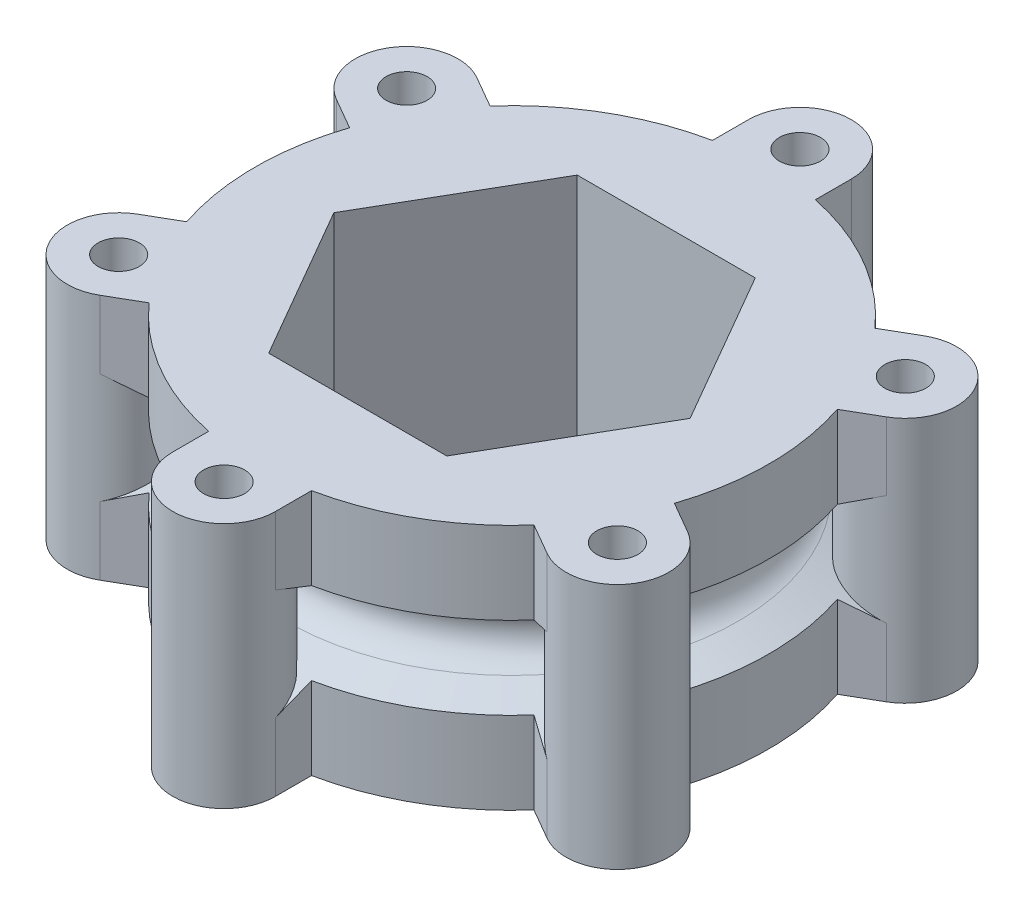
from build123d import *

# Parameters (mm, degrees)
SKETCH1_R           = 25.4
BOSS_EXTRUDE1_DEPTH = 7.62
CUT_EXTRUDE4_DEPTH  = 0.635
CIRPATTERN2_COUNT   = 20
BOSS_EXTRUDE2_REACH = 36.931
SKETCH5_R           = 3.175
SKETCH5_R_2         = 1.27
BOSS_EXTRUDE6_REACH = 36.931
SKETCH12_R          = 3.175
SKETCH17_R          = 1.27
CUT_EXTRUDE5_DEPTH  = 33.341392346
CIRPATTERN1_COUNT   = 3
CUT_EXTRUDE7_DEPTH  = 32.879827927


with BuildPart() as part:
    # Sketch1 → Boss-Extrude1 (new, symmetric)
    with BuildSketch(Plane(origin=(0, 0, 0), x_dir=(1, 0, 0), z_dir=(0, 1, 0))):
        Circle(SKETCH1_R)
    extrude(amount=BOSS_EXTRUDE1_DEPTH, both=True)

    # Sketch9 → Cut-Extrude4 (cut)
    with BuildSketch(Plane.ZY.offset(25.4)):
        Polygon((-0.635, -7.62), (0.635, -7.62), (0.635, 0), (0.635, 7.62), (-0.635, 7.62), (-0.635, 0), align=None)
    cut_extrude4 = extrude(amount=-CUT_EXTRUDE4_DEPTH, mode=Mode.SUBTRACT)

    # CirPattern2: Cut-Extrude4 ×20 about axis
    cirpattern2_axis = Axis((0, -7.62, 0), (0, 1, 0))
    for i in range(1, CIRPATTERN2_COUNT):
        add(cut_extrude4.rotate(cirpattern2_axis, i * 360 / CIRPATTERN2_COUNT), mode=Mode.SUBTRACT)

    # Sketch4 → Cut-Revolve2 (revolve, cut)
    with BuildSketch(Plane.XY):
        with BuildLine():
            Line((-25.4, -7.62), (-22.225, -7.62))
            Line((-22.225, -7.62), (-22.225, -5.08))
            Line((-22.225, -5.08), (-13.94687024, -1.768748096))
            ThreePointArc((-13.94687024, -1.768748096), (-12.749369479, 0), (-13.94687024, 1.768748096))
            Line((-13.94687024, 1.768748096), (-22.225, 5.08))
            Line((-22.225, 5.08), (-22.225, 7.62))
            Line((-22.225, 7.62), (-25.4, 7.62))
            Line((-25.4, 7.62), (-25.4, -7.62))
        make_face()
    revolve(axis=Axis((0, -9.0805, 0), (0, 1, 0)), mode=Mode.SUBTRACT)

    # Sketch5 → Boss-Extrude2 (add, up to next)
    with BuildSketch(Plane(origin=(0, 7.62, 0), x_dir=(1, 0, 0), z_dir=(0, 1, 0)), mode=Mode.PRIVATE) as boss_extrude2_sk1:
        with Locations((0, 17.78)):
            Circle(SKETCH5_R)
        with Locations((0, 17.78)):
            Circle(SKETCH5_R_2, mode=Mode.SUBTRACT)
    boss_extrude2_tool1 = extrude(boss_extrude2_sk1.sketch, amount=-BOSS_EXTRUDE2_REACH, mode=Mode.PRIVATE) - part.part
    boss_extrude2 = boss_extrude2_tool1.solids().sort_by_distance((-3.085197, 7.62, -17.78))[0]
    add(boss_extrude2)

    # Sketch12 → Boss-Extrude6 (add, up to next)
    with BuildSketch(Plane(origin=(0, 7.62, 0), x_dir=(1, 0, 0), z_dir=(0, 1, 0)), mode=Mode.PRIVATE) as boss_extrude6_sk1:
        with Locations((-15.397931679, 8.89)):
            Circle(SKETCH12_R)
    boss_extrude6_tool1 = extrude(boss_extrude6_sk1.sketch, amount=-BOSS_EXTRUDE6_REACH, mode=Mode.PRIVATE) - part.part
    boss_extrude6 = boss_extrude6_tool1.solids().sort_by_distance((-15.397932, 7.62, -8.89))[0]
    add(boss_extrude6)

    # Sketch17 → Cut-Extrude5 (cut, symmetric)
    with BuildSketch(Plane(origin=(0, 0, 0), x_dir=(1, 0, 0), z_dir=(0, 1, 0))):
        with Locations((0, 17.78)):
            Circle(SKETCH17_R)
        with Locations((-15.397931679, 8.89)):
            Circle(SKETCH17_R)
        with Locations((-15.397931679, -8.89)):
            Circle(SKETCH17_R)
        with BuildLine():
            Line((-18.147562336, -10.4775), (-19.247414599, -11.1125))
            ThreePointArc((-19.247414599, -11.1125), (-19.247414599, 11.1125), (0, 22.225))
            Line((0, 22.225), (0, 20.955))
            ThreePointArc((0, 20.955), (-2.24506403, 20.02506403), (-3.175, 17.78))
            Line((-3.175, 17.78), (-3.175, 15.554259867))
            ThreePointArc((-3.175, 15.554259867), (-7.9375, 13.748153285), (-11.882884182, 10.52676059))
            Line((-11.882884182, 10.52676059), (-13.810431679, 11.639630657))
            ThreePointArc((-13.810431679, 11.639630657), (-18.147562336, 10.4775), (-16.985431679, 6.140369343))
            Line((-16.985431679, 6.140369343), (-15.057884182, 5.027499276))
            ThreePointArc((-15.057884182, 5.027499276), (-15.875, 0), (-15.057884182, -5.027499276))
            Line((-15.057884182, -5.027499276), (-16.985431679, -6.140369343))
            ThreePointArc((-16.985431679, -6.140369343), (-18.464746178, -8.068249532), (-18.147562336, -10.4775))
        make_face()
    cut_extrude5 = extrude(amount=CUT_EXTRUDE5_DEPTH, both=True, mode=Mode.SUBTRACT)

    # CirPattern1: Boss-Extrude2, Boss-Extrude6, Cut-Extrude5 ×3 about axis
    cirpattern1_axis = Axis((0, 5.08, 0), (0, -1, 0))
    add([boss_extrude2.rotate(cirpattern1_axis, i * 360 / CIRPATTERN1_COUNT) for i in range(1, CIRPATTERN1_COUNT)])
    add([boss_extrude6.rotate(cirpattern1_axis, i * 360 / CIRPATTERN1_COUNT) for i in range(1, CIRPATTERN1_COUNT)])
    add([cut_extrude5.rotate(cirpattern1_axis, i * 360 / CIRPATTERN1_COUNT) for i in range(1, CIRPATTERN1_COUNT)], mode=Mode.SUBTRACT)

    # Sketch24 → Cut-Extrude7 (cut, through all)
    with BuildSketch(Plane.XZ.offset(7.62)):
        Polygon((5.499261314, -9.525), (10.998522628, 0), (5.499261314, 9.525), (-5.499261314, 9.525), (-10.998522628, 0), (-5.499261314, -9.525), align=None)
    extrude(amount=-CUT_EXTRUDE7_DEPTH, mode=Mode.SUBTRACT)


solid = part.part
